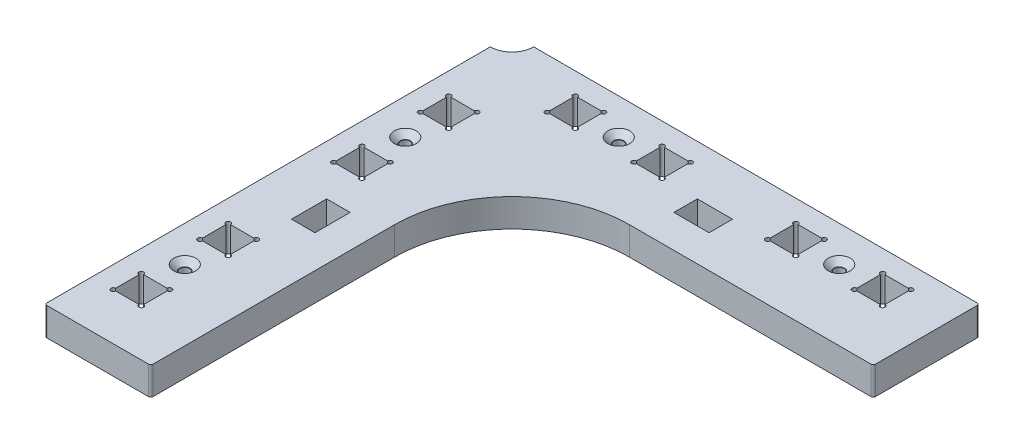
from build123d import *

# Parameters (mm, degrees)
SKETCH1_R                   = 2
SKETCH1_W                   = 10
SKETCH1_H                   = 15
SKETCH1_W_2                 = 15
SKETCH1_H_2                 = 10
SKETCH1_W_3                 = 12
SKETCH1_H_3                 = 12
BOSS_EXTRUDE1_DEPTH         = 12
SKETCH2_R                   = 1
CUT_EXTRUDE1_DEPTH          = 12
ADVANCEDHOLE1_OUTLINE_R     = 2.25
ADVANCEDHOLE1_OUTLINE_R_2   = 2
ADVANCEDHOLE1_DEPTH         = 2.45
ADVANCEDHOLE1_DRAFT         = -45
ADVANCEDHOLE1_2_OUTLINE_R   = 2.25
ADVANCEDHOLE1_2_OUTLINE_R_2 = 2
ADVANCEDHOLE1_2_DEPTH       = 2.45
ADVANCEDHOLE1_2_DRAFT       = -45
ADVANCEDHOLE1_3_OUTLINE_R   = 2.25
ADVANCEDHOLE1_3_OUTLINE_R_2 = 2
ADVANCEDHOLE1_3_DEPTH       = 2.45
ADVANCEDHOLE1_3_DRAFT       = -45
ADVANCEDHOLE1_4_OUTLINE_R   = 2.25
ADVANCEDHOLE1_4_OUTLINE_R_2 = 2
ADVANCEDHOLE1_4_DEPTH       = 2.45
ADVANCEDHOLE1_4_DRAFT       = -45


# Read off the part's stored shape, not the designer's step: AdvancedHole1
with BuildPart() as part:
    # Sketch1 → Boss-Extrude1 (new body)
    with BuildSketch(Plane(origin=(0, 0, 0), x_dir=(1, 0, 0), z_dir=(0, 1, 0))):
        with BuildLine():
            Line((0, 1), (0, 190))
            ThreePointArc((0, 190), (6.540737726, 192.709262274), (9.25, 199.25))
            Line((9.25, 199.25), (10.25, 199.25))
            Line((10.25, 199.25), (198.25, 199.25))
            ThreePointArc((198.25, 199.25), (198.957106781, 198.957106781), (199.25, 198.25))
            Line((199.25, 198.25), (199.25, 155))
            ThreePointArc((199.25, 155), (198.957106781, 154.292893219), (198.25, 154))
            Line((198.25, 154), (95.25, 154))
            ThreePointArc((95.25, 154), (59.894660941, 139.355339059), (45.25, 104))
            Line((45.25, 104), (45.25, 1))
            ThreePointArc((45.25, 1), (44.957106781, 0.292893219), (44.25, 0))
            Line((44.25, 0), (1, 0))
            ThreePointArc((1, 0), (0.292893219, 0.292893219), (0, 1))
        make_face()
        with Locations(Location((60.75, 184, 0), (0, 0, 270))):
            Circle(SKETCH1_R, mode=Mode.SUBTRACT)
        with Locations(Location((154.75, 184, 0), (0, 0, 270))):
            Circle(SKETCH1_R, mode=Mode.SUBTRACT)
        with Locations(Location((15.25, 138.5, 0), (0, 0, 270))):
            Circle(SKETCH1_R, mode=Mode.SUBTRACT)
        with Locations(Location((15.25, 44.5, 0), (0, 0, 270))):
            Circle(SKETCH1_R, mode=Mode.SUBTRACT)
        with Locations((26.25, 91.5)):
            Rectangle(SKETCH1_W, SKETCH1_H, mode=Mode.SUBTRACT)
        with Locations((107.75, 173)):
            Rectangle(SKETCH1_W_2, SKETCH1_H_2, mode=Mode.SUBTRACT)
        with Locations((42.25, 184)):
            Rectangle(SKETCH1_W_3, SKETCH1_H_3, mode=Mode.SUBTRACT)
        with Locations((173.25, 184)):
            Rectangle(SKETCH1_W_3, SKETCH1_H_3, mode=Mode.SUBTRACT)
        with Locations((79.25, 184)):
            Rectangle(SKETCH1_W_3, SKETCH1_H_3, mode=Mode.SUBTRACT)
        with Locations((136.25, 184)):
            Rectangle(SKETCH1_W_3, SKETCH1_H_3, mode=Mode.SUBTRACT)
        with Locations((15.25, 120)):
            Rectangle(SKETCH1_W_3, SKETCH1_H_3, mode=Mode.SUBTRACT)
        with Locations((15.25, 26)):
            Rectangle(SKETCH1_W_3, SKETCH1_H_3, mode=Mode.SUBTRACT)
        with Locations((15.25, 63)):
            Rectangle(SKETCH1_W_3, SKETCH1_H_3, mode=Mode.SUBTRACT)
        with Locations((15.25, 157)):
            Rectangle(SKETCH1_W_3, SKETCH1_H_3, mode=Mode.SUBTRACT)
    extrude(amount=BOSS_EXTRUDE1_DEPTH)

    # Sketch2 → Cut-Extrude1 (cut)
    with BuildSketch(Plane(origin=(0, 0, 0), x_dir=(1, 0, 0), z_dir=(0, 1, 0))):
        with Locations((9.25, 151)):
            Circle(SKETCH2_R)
        with Locations((9.25, 163)):
            Circle(SKETCH2_R)
        with Locations((21.25, 163)):
            Circle(SKETCH2_R)
        with Locations((21.25, 151)):
            Circle(SKETCH2_R)
        with Locations((21.25, 126)):
            Circle(SKETCH2_R)
        with Locations((9.25, 114)):
            Circle(SKETCH2_R)
        with Locations((9.25, 126)):
            Circle(SKETCH2_R)
        with Locations((21.25, 114)):
            Circle(SKETCH2_R)
        with Locations((21.25, 69)):
            Circle(SKETCH2_R)
        with Locations((21.25, 57)):
            Circle(SKETCH2_R)
        with Locations((9.25, 57)):
            Circle(SKETCH2_R)
        with Locations((9.25, 69)):
            Circle(SKETCH2_R)
        with Locations((21.25, 32)):
            Circle(SKETCH2_R)
        with Locations((21.25, 20)):
            Circle(SKETCH2_R)
        with Locations((9.25, 20)):
            Circle(SKETCH2_R)
        with Locations((9.25, 32)):
            Circle(SKETCH2_R)
        with Locations((48.25, 178)):
            Circle(SKETCH2_R)
        with Locations((48.25, 190)):
            Circle(SKETCH2_R)
        with Locations((36.25, 190)):
            Circle(SKETCH2_R)
        with Locations((36.25, 178)):
            Circle(SKETCH2_R)
        with Locations((73.25, 178)):
            Circle(SKETCH2_R)
        with Locations((85.25, 178)):
            Circle(SKETCH2_R)
        with Locations((85.25, 190)):
            Circle(SKETCH2_R)
        with Locations((73.25, 190)):
            Circle(SKETCH2_R)
        with Locations((130.25, 178)):
            Circle(SKETCH2_R)
        with Locations((130.25, 190)):
            Circle(SKETCH2_R)
        with Locations((142.25, 190)):
            Circle(SKETCH2_R)
        with Locations((142.25, 178)):
            Circle(SKETCH2_R)
        with Locations((167.25, 178)):
            Circle(SKETCH2_R)
        with Locations((167.25, 190)):
            Circle(SKETCH2_R)
        with Locations((179.25, 190)):
            Circle(SKETCH2_R)
        with Locations((179.25, 178)):
            Circle(SKETCH2_R)
    extrude(amount=CUT_EXTRUDE1_DEPTH, mode=Mode.SUBTRACT)


with BuildPart() as advancedhole1_tool:
    # AdvancedHole1 outline → AdvancedHole1 (with draft: the straight prism first)
    with BuildSketch(Plane(origin=(0, 9.55, 0), x_dir=(1, 0, 0), z_dir=(0, 1, 0))):
        with Locations((154.75, 184)):
            Circle(ADVANCEDHOLE1_OUTLINE_R)
        with Locations((154.75, 184)):
            Circle(ADVANCEDHOLE1_OUTLINE_R_2, mode=Mode.SUBTRACT)
    extrude(amount=ADVANCEDHOLE1_DEPTH)
    # AdvancedHole1: the draft: its side faces are tilted about the plane it starts from
    advancedhole1_sides = [advancedhole1_tool.faces().sort_by_distance(p)[0] for p in [
        (152.5, 10.775, -184),
        (152.75, 10.775, -184),
    ]]
    draft(advancedhole1_sides, Plane(origin=(0, 9.55, 0), x_dir=(1, 0, 0), z_dir=(0, 1, 0)), ADVANCEDHOLE1_DRAFT)


with BuildPart() as part_1:
    add(part.part)

    # AdvancedHole1: cut by advancedhole1_tool
    add(advancedhole1_tool.part, mode=Mode.SUBTRACT)


with BuildPart() as advancedhole1_2_tool:
    # AdvancedHole1 2 outline → AdvancedHole1 2 (with draft: the straight prism first)
    with BuildSketch(Plane(origin=(0, 9.55, 0), x_dir=(1, 0, 0), z_dir=(0, 1, 0))):
        with Locations((60.75, 184)):
            Circle(ADVANCEDHOLE1_2_OUTLINE_R)
        with Locations((60.75, 184)):
            Circle(ADVANCEDHOLE1_2_OUTLINE_R_2, mode=Mode.SUBTRACT)
    extrude(amount=ADVANCEDHOLE1_2_DEPTH)
    # AdvancedHole1 2: the draft: its side faces are tilted about the plane it starts from
    advancedhole1_2_sides = [advancedhole1_2_tool.faces().sort_by_distance(p)[0] for p in [
        (58.5, 10.775, -184),
        (58.75, 10.775, -184),
    ]]
    draft(advancedhole1_2_sides, Plane(origin=(0, 9.55, 0), x_dir=(1, 0, 0), z_dir=(0, 1, 0)), ADVANCEDHOLE1_2_DRAFT)


with BuildPart() as part_2:
    add(part_1.part)

    # AdvancedHole1 2: cut by advancedhole1_2_tool
    add(advancedhole1_2_tool.part, mode=Mode.SUBTRACT)


with BuildPart() as advancedhole1_3_tool:
    # AdvancedHole1 3 outline → AdvancedHole1 3 (with draft: the straight prism first)
    with BuildSketch(Plane(origin=(0, 9.55, 0), x_dir=(1, 0, 0), z_dir=(0, 1, 0))):
        with Locations((15.25, 138.5)):
            Circle(ADVANCEDHOLE1_3_OUTLINE_R)
        with Locations((15.25, 138.5)):
            Circle(ADVANCEDHOLE1_3_OUTLINE_R_2, mode=Mode.SUBTRACT)
    extrude(amount=ADVANCEDHOLE1_3_DEPTH)
    # AdvancedHole1 3: the draft: its side faces are tilted about the plane it starts from
    advancedhole1_3_sides = [advancedhole1_3_tool.faces().sort_by_distance(p)[0] for p in [
        (13, 10.775, -138.5),
        (13.25, 10.775, -138.5),
    ]]
    draft(advancedhole1_3_sides, Plane(origin=(0, 9.55, 0), x_dir=(1, 0, 0), z_dir=(0, 1, 0)), ADVANCEDHOLE1_3_DRAFT)


with BuildPart() as part_3:
    add(part_2.part)

    # AdvancedHole1 3: cut by advancedhole1_3_tool
    add(advancedhole1_3_tool.part, mode=Mode.SUBTRACT)


with BuildPart() as advancedhole1_4_tool:
    # AdvancedHole1 4 outline → AdvancedHole1 4 (with draft: the straight prism first)
    with BuildSketch(Plane(origin=(0, 9.55, 0), x_dir=(1, 0, 0), z_dir=(0, 1, 0))):
        with Locations((15.25, 44.5)):
            Circle(ADVANCEDHOLE1_4_OUTLINE_R)
        with Locations((15.25, 44.5)):
            Circle(ADVANCEDHOLE1_4_OUTLINE_R_2, mode=Mode.SUBTRACT)
    extrude(amount=ADVANCEDHOLE1_4_DEPTH)
    # AdvancedHole1 4: the draft: its side faces are tilted about the plane it starts from
    advancedhole1_4_sides = [advancedhole1_4_tool.faces().sort_by_distance(p)[0] for p in [
        (13, 10.775, -44.5),
        (13.25, 10.775, -44.5),
    ]]
    draft(advancedhole1_4_sides, Plane(origin=(0, 9.55, 0), x_dir=(1, 0, 0), z_dir=(0, 1, 0)), ADVANCEDHOLE1_4_DRAFT)


with BuildPart() as part_4:
    add(part_3.part)

    # AdvancedHole1 4: cut by advancedhole1_4_tool
    add(advancedhole1_4_tool.part, mode=Mode.SUBTRACT)


solid = part_4.part
